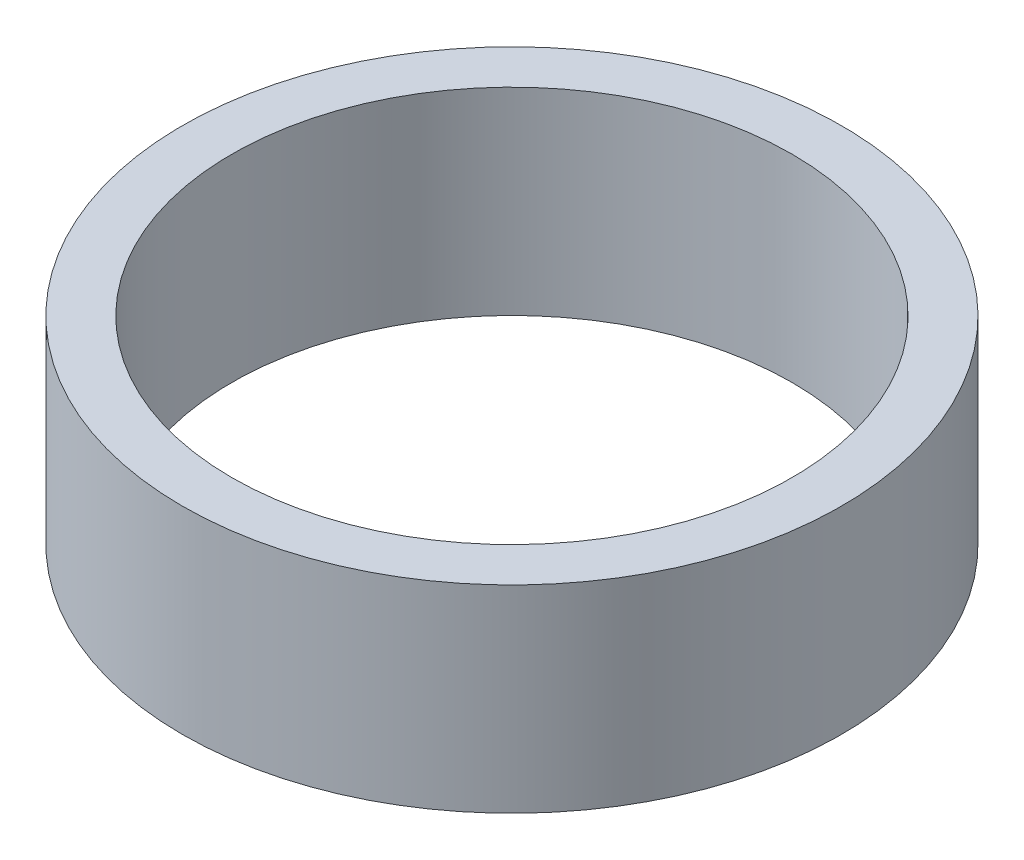
from build123d import *

# Parameters (mm, degrees)
SKETCH1_R           = 50
BOSS_EXTRUDE1_DEPTH = 30
SKETCH2_R           = 42.5
CUT_EXTRUDE1_DEPTH  = 77.811457479


with BuildPart() as part:
    # Sketch1 → Boss-Extrude1 (new body)
    with BuildSketch(Plane(origin=(0, 0, 0), x_dir=(1, 0, 0), z_dir=(0, 1, 0))):
        Circle(SKETCH1_R)
    extrude(amount=BOSS_EXTRUDE1_DEPTH)

    # Sketch2 → Cut-Extrude1 (cut, through all)
    with BuildSketch(Plane(origin=(0, 0, 0), x_dir=(1, 0, 0), z_dir=(0, 1, 0))):
        Circle(SKETCH2_R)
    extrude(amount=CUT_EXTRUDE1_DEPTH, mode=Mode.SUBTRACT)


solid = part.part
